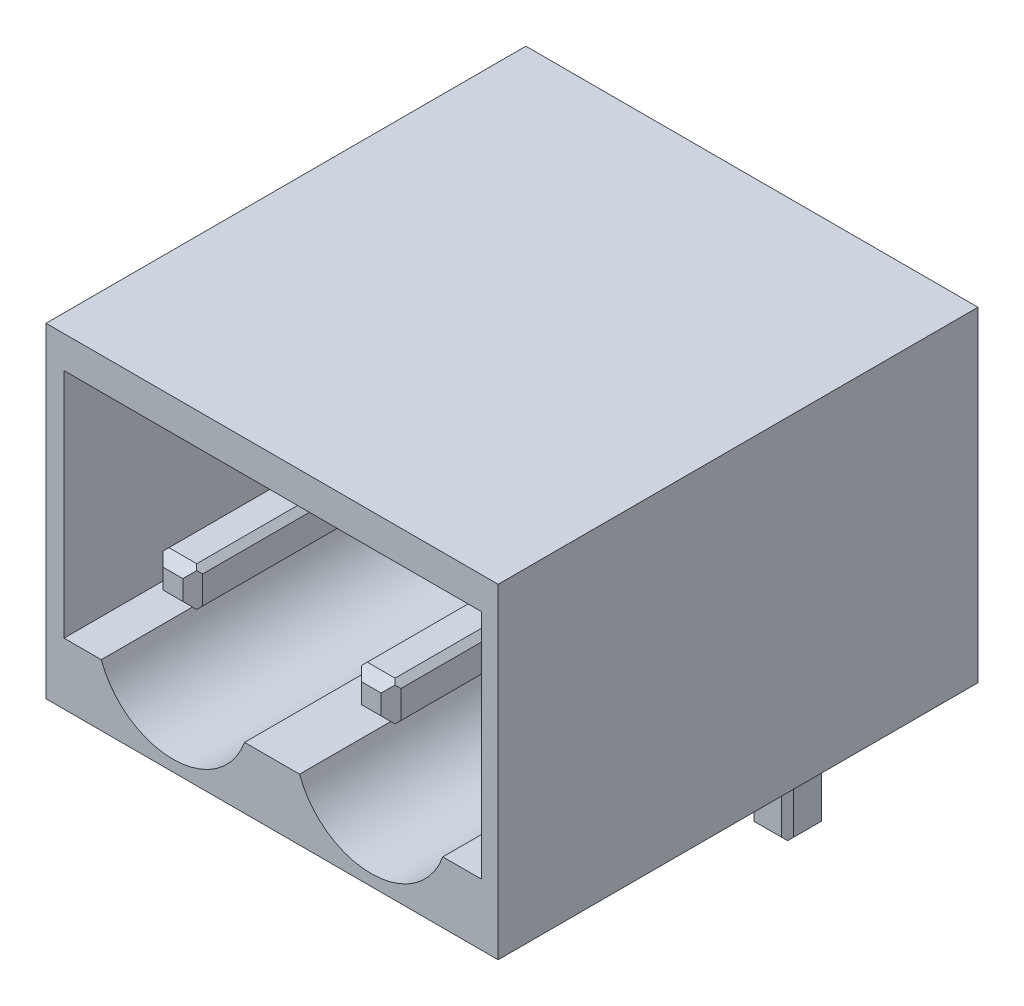
from build123d import *

# Parameters (mm, degrees)
SKETCH_1_W          = 11.4
SKETCH_1_H          = 8.2
EXTRUDE_1_DEPTH     = 12.1
SKETCH_4_R          = 1.25
CUT_EXTRUDE_3_DEPTH = 8
CUT_EXTRUDE_4_DEPTH = 7.8
SKETCH_7_W          = 1
SKETCH_7_H          = 1
EXTRUDE_2_DEPTH     = 8
CHAMFER_1_SIZE      = 0.15
CHAMFER_2_SIZE      = 0.25
SKETCH_8_W          = 1
SKETCH_8_H          = 1
EXTRUDE_3_DEPTH     = 4
CHAMFER_3_SIZE      = 0.15
CHAMFER_4_SIZE      = 0.25


with BuildPart() as part:
    # Эскиз1 → Бобышка-Вытянуть1 (new body)
    with BuildSketch(Plane.XY):
        Rectangle(SKETCH_1_W, SKETCH_1_H)
    extrude(amount=EXTRUDE_1_DEPTH)

    # Эскиз4 → Вырез-Вытянуть3 (cut)
    with BuildSketch(Plane.XY.offset(12.1)):
        with Locations((-2.5, 0)):
            Circle(SKETCH_4_R)
        with Locations((2.5, 0)):
            Circle(SKETCH_4_R)
    extrude(amount=-CUT_EXTRUDE_3_DEPTH, mode=Mode.SUBTRACT)

    # Эскиз5 → Вырез-Вытянуть4 (cut)
    with BuildSketch(Plane.XY.offset(12.1)):
        with BuildLine():
            Line((-5.245621634, 0), (-5.245621634, 3.292901982))
            Line((-5.245621634, 3.292901982), (5.278509544, 3.292901982))
            Line((5.278509544, 3.292901982), (5.278509544, -2.548957219))
            Line((5.278509544, -2.548957219), (4.30582632, -2.548957219))
            ThreePointArc((4.30582632, -2.548957219), (2.5, -3.818893996), (0.69417368, -2.548957219))
            Line((0.69417368, -2.548957219), (-0.69417368, -2.548957219))
            ThreePointArc((-0.69417368, -2.548957219), (-2.5, -3.818893996), (-4.30582632, -2.548957219))
            Line((-4.30582632, -2.548957219), (-5.245621634, -2.548957219))
            Line((-5.245621634, -2.548957219), (-5.245621634, 0))
        make_face()
    extrude(amount=-CUT_EXTRUDE_4_DEPTH, mode=Mode.SUBTRACT)

    # Эскиз7 → Бобышка-Вытянуть2 (add)
    with BuildSketch(Plane.XY.offset(4.1)):
        with Locations((2.5, 0)):
            Rectangle(SKETCH_7_W, SKETCH_7_H)
        with Locations((-2.5, 0)):
            Rectangle(SKETCH_7_W, SKETCH_7_H)
    extrude(amount=EXTRUDE_2_DEPTH)

    # Фаска1
    chamfer_1_edges = [part.edges().sort_by_distance(p)[0] for p in [
        (-2, -0.5, 8.1),
        (-2, 0.5, 8.1),
        (-3, 0.5, 8.1),
        (-3, -0.5, 8.1),
        (3, -0.5, 8.1),
        (3, 0.5, 8.1),
        (2, 0.5, 8.1),
        (2, -0.5, 8.1),
    ]]
    chamfer(chamfer_1_edges, length=CHAMFER_1_SIZE)

    # Фаска2
    # the kernel refuses this chamfer: 0.25 mm, written as the material it takes off along each edge
    with BuildSketch(Plane(origin=(2, -0.992920747, 12.1), x_dir=(-0.027495876610586414, 0, -0.9996219169112968), z_dir=(0, 1, 0)), Plane(origin=(1.507079253, 0.5, 12.1), x_dir=(0, 0.027495876610586414, -0.9996219169112968), z_dir=(1, 0, 0)), Plane(origin=(3, 0.992920747, 12.1), x_dir=(0.02749587661058555, 0, -0.9996219169112968), z_dir=(0, -1, 0)), Plane(origin=(3.492920747, -0.5, 12.1), x_dir=(0, -0.027495876610586414, -0.9996219169112968), z_dir=(-1, 0, 0)), Plane(origin=(-2, 0.992920747, 12.1), x_dir=(0.027495876610586414, 0, -0.9996219169112968), z_dir=(0, -1, 0)), Plane(origin=(-1.507079253, -0.5, 12.1), x_dir=(0, -0.027495876610586414, -0.9996219169112968), z_dir=(-1, 0, 0)), Plane(origin=(-3, -0.992920747, 12.1), x_dir=(-0.02749587661058555, 0, -0.9996219169112968), z_dir=(0, 1, 0)), Plane(origin=(-3.492920747, 0.5, 12.1), x_dir=(0, 0.027495876610586414, -0.9996219169112968), z_dir=(1, 0, 0))) as chamfer_2_piece_1:
        Polygon((CHAMFER_2_SIZE * 0.999621916911, -CHAMFER_2_SIZE * 0.0274958766106), (-CHAMFER_2_SIZE * 0.0274958766106, -CHAMFER_2_SIZE * 0.999621916911), (0, 0), align=None)
    extrude(amount=1.985841494, mode=Mode.SUBTRACT)

    # Эскиз8 → Бобышка-Вытянуть3 (add)
    with BuildSketch(Plane(origin=(0, -4.1, 0), x_dir=(-1, 0, 0), z_dir=(0, -1, 0))):
        with Locations((-2.5, -1.6)):
            Rectangle(SKETCH_8_W, SKETCH_8_H)
        with Locations((2.5, -1.6)):
            Rectangle(SKETCH_8_W, SKETCH_8_H)
    extrude(amount=EXTRUDE_3_DEPTH)

    # Фаска3
    chamfer_3_edges = [part.edges().sort_by_distance(p)[0] for p in [
        (-2, -6.1, 1.1),
        (-2, -6.1, 2.1),
        (-3, -6.1, 2.1),
        (-3, -6.1, 1.1),
        (3, -6.1, 1.1),
        (3, -6.1, 2.1),
        (2, -6.1, 2.1),
        (2, -6.1, 1.1),
    ]]
    chamfer(chamfer_3_edges, length=CHAMFER_3_SIZE)

    # Фаска4
    # the kernel refuses this chamfer: 0.25 mm, written as the material it takes off along each edge
    with BuildSketch(Plane(origin=(3, -8.1, 2.592920747), x_dir=(0.027495876610585647, 0.9996219169112968, 0), z_dir=(0, 0, -1)), Plane(origin=(2, -8.1, 0.607079253), x_dir=(-0.02749587661058651, 0.9996219169112968, 0), z_dir=(0, 0, 1)), Plane(origin=(1.507079253, -8.1, 2.1), x_dir=(0, 0.9996219169112968, 0.027495876610585647), z_dir=(1, 0, 0)), Plane(origin=(3.492920747, -8.1, 1.1), x_dir=(0, 0.9996219169112968, -0.02749587661058651), z_dir=(-1, 0, 0)), Plane(origin=(-3, -8.1, 0.607079253), x_dir=(-0.027495876610585647, 0.9996219169112968, 0), z_dir=(0, 0, 1)), Plane(origin=(-3.492920747, -8.1, 2.1), x_dir=(0, 0.9996219169112968, 0.027495876610585647), z_dir=(1, 0, 0)), Plane(origin=(-2, -8.1, 2.592920747), x_dir=(0.02749587661058651, 0.9996219169112968, 0), z_dir=(0, 0, -1)), Plane(origin=(-1.507079253, -8.1, 1.1), x_dir=(0, 0.9996219169112968, -0.02749587661058651), z_dir=(-1, 0, 0))) as chamfer_4_piece_1:
        Polygon((CHAMFER_4_SIZE * 0.999621916911, -CHAMFER_4_SIZE * 0.0274958766106), (-CHAMFER_4_SIZE * 0.0274958766106, -CHAMFER_4_SIZE * 0.999621916911), (0, 0), align=None)
    extrude(amount=1.985841494, mode=Mode.SUBTRACT)


solid = part.part
